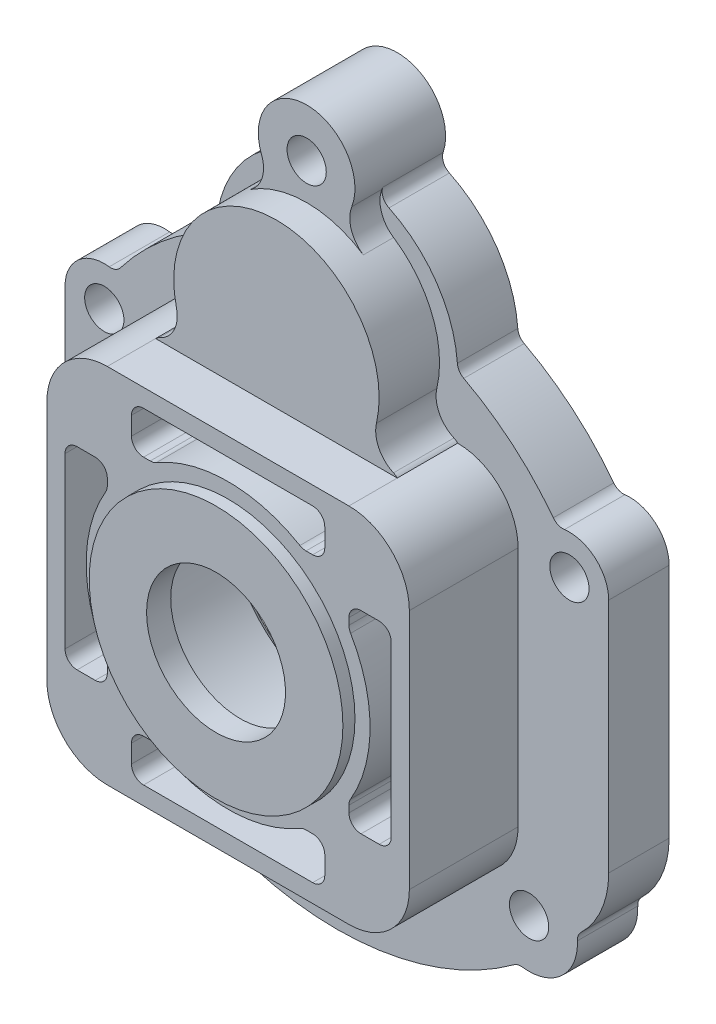
from build123d import *

# Parameters (mm, degrees)
SKETCH_1_R               = 8
EXTRUDE_1_DEPTH          = 10
FILLET_2_R               = 2
EXTRUDE_2_DEPTH          = 18
SKETCH_3_R               = 21
EXTRUDE_3_DEPTH          = 2
EXTRUDE_4_DEPTH          = 10
EXTRUDE_5_DEPTH          = 5
SKETCH_7_R               = 3.25
CUT_EXTRUDE_1_DEPTH      = 86.387352847
SKETCH_8_R               = 3.25
CUT_EXTRUDE_2_DEPTH      = 87.406018443
SKETCH_9_R               = 4
CUT_EXTRUDE_3_DEPTH      = 87.406018443
CUT_EXTRUDE_5_DEPTH      = 6.5
SKETCH_11_R              = 13
CUT_EXTRUDE_6_DEPTH      = 9
SKETCH_12_R              = 11.8
CUT_EXTRUDE_7_DEPTH      = 0.5
CHAMFER_1_SIZE           = 1
FILLET_3_R               = 2
CUT_EXTRUDE_START        = 4
SKETCH_13_R              = 21
CUT_EXTRUDE_8_DEPTH      = 86.25245111
CHAMFER_2_SIZE           = 1
SKETCH_14_R              = 11.5
CUT_EXTRUDE_9_DEPTH      = 88.988635791
CUT_EXTRUDE_10_DEPTH     = 8
PATTERN_CIRCULAR_1_COUNT = 4
CUT_EXTRUDE_START_2      = -8
CUT_EXTRUDE_11_DEPTH     = 8
PATTERN_CIRCULAR_2_COUNT = 4


with BuildPart() as part:
    # 草图1 → 凸台-拉伸1 (new body)
    with BuildSketch(Plane.XY):
        with BuildLine():
            ThreePointArc((-36.579346649, 26.209757701), (-42.357833149, 25.231359612), (-45, 20))
            Line((-45, 20), (-45, -19.12073832))
            ThreePointArc((-45, -19.12073832), (-43.615594549, -25.414829603), (-39.717921989, -30.547110982))
            ThreePointArc((-39.717921989, -30.547110982), (-31.181422307, -23.845316622), (-23.819805153, -31.819805153))
            ThreePointArc((-23.819805153, -31.819805153), (-25.552491485, -36.791804689), (-30, -39.610075316))
            ThreePointArc((-30, -39.610075316), (0, -49.688611034), (30, -39.610075316))
            ThreePointArc((30, -39.610075316), (26.363542801, -25.969232434), (39.717921989, -30.547110982))
            ThreePointArc((39.717921989, -30.547110982), (43.615594549, -25.414829603), (45, -19.12073832))
            Line((45, -19.12073832), (45, 20))
            ThreePointArc((45, 20), (42.357833149, 25.231359612), (36.579346649, 26.209757701))
            ThreePointArc((36.579346649, 26.209757701), (29.154045733, 34.278880049), (19.997558445, 40.3125))
            ThreePointArc((19.997558445, 40.3125), (16.283994711, 51.611697389), (6.811497841, 58.804347826))
            ThreePointArc((6.811497841, 58.804347826), (0, 55), (-6.811497841, 58.804347826))
            ThreePointArc((-6.811497841, 58.804347826), (-16.283994711, 51.611697389), (-19.997558445, 40.3125))
            ThreePointArc((-19.997558445, 40.3125), (-29.154045733, 34.278880049), (-36.579346649, 26.209757701))
        make_face()
        with Locations((0, 63)):
            Circle(SKETCH_1_R)
        with Locations((-31.819805153, -31.819805153)):
            Circle(SKETCH_1_R)
        with Locations((31.819805153, -31.819805153)):
            Circle(SKETCH_1_R)
    extrude(amount=EXTRUDE_1_DEPTH)

    # 圆角2
    fillet_2_edges = [part.edges().sort_by_distance(p)[0] for p in [
        (39.717921989, -30.547110982, 5),
        (30, -39.610075316, 5),
        (-30, -39.610075316, 5),
        (-39.717921989, -30.547110982, 5),
        (-36.579346649, 26.209757701, 5),
        (-19.997558445, 40.3125, 5),
        (-6.811497841, 58.804347826, 5),
        (6.811497841, 58.804347826, 5),
        (19.997558445, 40.3125, 5),
        (36.579346649, 26.209757701, 5),
    ]]
    fillet(fillet_2_edges, radius=FILLET_2_R)

    # 草图2 → 凸台-拉伸2 (add)
    with BuildSketch(Plane.XY.offset(10)):
        with BuildLine():
            Line((-20, -30), (20, -30))
            ThreePointArc((20, -30), (27.071067812, -27.071067812), (30, -20))
            Line((30, -20), (30, 20))
            ThreePointArc((30, 20), (27.071067812, 27.071067812), (20, 30))
            Line((20, 30), (-20, 30))
            ThreePointArc((-20, 30), (-27.071067812, 27.071067812), (-30, 20))
            Line((-30, 20), (-30, -20))
            ThreePointArc((-30, -20), (-27.071067812, -27.071067812), (-20, -30))
        make_face()
    extrude(amount=EXTRUDE_2_DEPTH)

    # 草图3 → 凸台-拉伸3 (add)
    with BuildSketch(Plane.XY.offset(28)):
        Circle(SKETCH_3_R)
    extrude(amount=EXTRUDE_3_DEPTH)

    # 草图4 → 凸台-拉伸4 (add)
    with BuildSketch(Plane.XY.offset(10)):
        with BuildLine():
            ThreePointArc((-16.553884547, 36.131032903), (-17.425164742, 31.989783443), (-21.160112951, 30))
            Line((-21.160112951, 30), (21.310598843, 30))
            ThreePointArc((21.310598843, 30), (17.47215611, 31.9355382), (16.554897625, 36.135370055))
            ThreePointArc((16.554897625, 36.135370055), (-0.002226949, 56.999999854), (-16.553884547, 36.131032903))
        make_face()
    extrude(amount=EXTRUDE_4_DEPTH)

    # 草图6 → 凸台-拉伸5 (add)
    with BuildSketch(Plane.XY.offset(10)):
        with BuildLine():
            ThreePointArc((-7.470203448, 60.137123746), (-7.377663721, 56.821749655), (-9.380198648, 54.177865613))
            ThreePointArc((-9.380198648, 54.177865613), (0, 57), (9.380198648, 54.177865613))
            ThreePointArc((9.380198648, 54.177865613), (7.377663721, 56.821749655), (7.470203448, 60.137123746))
            ThreePointArc((7.470203448, 60.137123746), (7.53311099, 60.307001891), (7.592155936, 60.47826087))
            ThreePointArc((7.592155936, 60.47826087), (0, 71), (-7.592155936, 60.47826087))
            ThreePointArc((-7.592155936, 60.47826087), (-7.53311099, 60.307001891), (-7.470203448, 60.137123746))
        make_face()
    extrude(amount=EXTRUDE_5_DEPTH)

    # 草图7 → 切除-拉伸1 (cut, through all)
    with BuildSketch(Plane.XY.offset(15)):
        with Locations((0, 63)):
            Circle(SKETCH_7_R)
    extrude(amount=-CUT_EXTRUDE_1_DEPTH, mode=Mode.SUBTRACT)

    # 草图8 → 切除-拉伸2 (cut, through all)
    with BuildSketch(Plane.XY.offset(10)):
        with Locations((-38.5, 20)):
            Circle(SKETCH_8_R)
        with Locations((38.5, 20)):
            Circle(SKETCH_8_R)
        with Locations((31.819805153, -31.819805153)):
            Circle(SKETCH_8_R)
    extrude(amount=-CUT_EXTRUDE_2_DEPTH, mode=Mode.SUBTRACT)

    # 草图9 → 切除-拉伸3 (cut, through all)
    with BuildSketch(Plane.XY.offset(10)):
        with Locations((-31.819805153, -31.819805153)):
            Circle(SKETCH_9_R)
    extrude(amount=-CUT_EXTRUDE_3_DEPTH, mode=Mode.SUBTRACT)

    # 草图10 → 切除-拉伸5 (cut)
    with BuildSketch(Plane(origin=(0, 0, 0), x_dir=(-1, 0, 0), z_dir=(0, 0, -1))):
        with BuildLine():
            ThreePointArc((-24.321193093, -38.677238071), (-12.655826566, -43.900788514), (0, -45.688611034))
            Line((0, -45.688611034), (0, 56))
            ThreePointArc((0, 56), (-3.538606948, 55.603789952), (-6.901959942, 54.434782609))
            ThreePointArc((-6.901959942, 54.434782609), (-13.224018384, 49.006960519), (-15.95959516, 41.136363636))
            ThreePointArc((-15.95959516, 41.136363636), (-16.919254436, 38.284165602), (-19.143025046, 36.256648936))
            ThreePointArc((-19.143025046, 36.256648936), (-26.194471911, 31.541237155), (-32.124620679, 25.475650065))
            ThreePointArc((-32.124620679, 25.475650065), (-32.549398196, 24.413502723), (-32.322551342, 23.292283111))
            ThreePointArc((-32.322551342, 23.292283111), (-32.600506447, 16.232245255), (-38.888888889, 13.010810817))
            ThreePointArc((-38.888888889, 13.010810817), (-40.374368542, 12.466865937), (-41, 11.013899622))
            Line((-41, 11.013899622), (-41, -19.12073832))
            ThreePointArc((-41, -19.12073832), (-40.601810391, -22.053589566), (-39.43606974, -24.774107922))
            ThreePointArc((-39.43606974, -24.774107922), (-38.117648217, -25.706378222), (-36.540297588, -25.360939063))
            ThreePointArc((-36.540297588, -25.360939063), (-26.41858125, -25.918383262), (-24.969195392, -35.951287442))
            ThreePointArc((-24.969195392, -35.951287442), (-25.202321489, -37.446700862), (-24.321193093, -38.677238071))
        make_face()
        with BuildLine():
            Line((0, 56), (0, -45.688611034))
            ThreePointArc((0, -45.688611034), (12.655826566, -43.900788514), (24.321193093, -38.677238071))
            ThreePointArc((24.321193093, -38.677238071), (25.202321489, -37.446700862), (24.969195392, -35.951287442))
            ThreePointArc((24.969195392, -35.951287442), (26.41858125, -25.918383262), (36.540297588, -25.360939063))
            ThreePointArc((36.540297588, -25.360939063), (38.117648217, -25.706378222), (39.43606974, -24.774107922))
            ThreePointArc((39.43606974, -24.774107922), (40.601810391, -22.053589566), (41, -19.12073832))
            Line((41, -19.12073832), (41, 11.013899622))
            ThreePointArc((41, 11.013899622), (40.374368542, 12.466865937), (38.888888889, 13.010810817))
            ThreePointArc((38.888888889, 13.010810817), (32.600506447, 16.232245255), (32.322551342, 23.292283111))
            ThreePointArc((32.322551342, 23.292283111), (32.549398196, 24.413502723), (32.124620679, 25.475650065))
            ThreePointArc((32.124620679, 25.475650065), (26.194471911, 31.541237155), (19.143025046, 36.256648936))
            ThreePointArc((19.143025046, 36.256648936), (16.919254436, 38.284165602), (15.95959516, 41.136363636))
            ThreePointArc((15.95959516, 41.136363636), (13.224018384, 49.006960519), (6.901959942, 54.434782609))
            ThreePointArc((6.901959942, 54.434782609), (3.538606948, 55.603789952), (0, 56))
        make_face()
    extrude(amount=-CUT_EXTRUDE_5_DEPTH, mode=Mode.SUBTRACT)

    # 草图11 → 切除-拉伸6 (cut)
    with BuildSketch(Plane(origin=(0, 0, 6.5), x_dir=(-1, 0, 0), z_dir=(0, 0, -1))):
        with Locations((0, 40)):
            Circle(SKETCH_11_R)
    extrude(amount=-CUT_EXTRUDE_6_DEPTH, mode=Mode.SUBTRACT)

    # 草图12 → 切除-拉伸7 (cut)
    with BuildSketch(Plane(origin=(0, 0, 15.5), x_dir=(-1, 0, 0), z_dir=(0, 0, -1))):
        with Locations((0, 40)):
            Circle(SKETCH_12_R)
    extrude(amount=-CUT_EXTRUDE_7_DEPTH, mode=Mode.SUBTRACT)

    # 倒角1
    chamfer_1_edges = [part.edges().sort_by_distance(p)[0] for p in [
        (13, 40, 6.5),
    ]]
    chamfer(chamfer_1_edges, length=CHAMFER_1_SIZE)

    # 圆角3
    # the kernel refuses this fillet: 2 mm, written as the material it takes off along each edge
    with BuildSketch(Plane(origin=(21.310598843, 30, 10), x_dir=(-0.9754566193335542, 0.22019169784157075, 0), z_dir=(0, 0, 1))) as fillet_3_piece_1:
        with BuildLine():
            CenterArc((2.376172628, 1.960398228), FILLET_3_R, 236.710464592, 21.868665736)
            Line((1.278432316, 0.288582984), (0, 0))
            ThreePointArc((0, 0), (0.990071928, 0.09900443), (1.980143856, 0))
        make_face()
    extrude(amount=14.950359641, mode=Mode.SUBTRACT)
    with BuildSketch(Plane(origin=(-21.160112951, 30, 10), x_dir=(0.9722805183017327, 0.23381743675550404, 0), z_dir=(0, 0, 1))) as fillet_3_piece_2:
        with BuildLine():
            CenterArc((2.18925855, -1.96643464), FILLET_3_R, 100.51181111, 21.537684626)
            Line((1.127955221, -0.271254637), (0, 0))
            ThreePointArc((0, 0), (0.912191062, -0.083913399), (1.824382125, 0))
        make_face()
    extrude(amount=14.560955312, mode=Mode.SUBTRACT)

    # 草图13 → 切除-拉伸8 (cut, through all)
    with BuildSketch(Plane(origin=(0, 0, 30), x_dir=(-1, 0, 0), z_dir=(0, 0, -1)).offset(CUT_EXTRUDE_START)):
        with Locations(Location((0, 0, 0), (0, 0, 180))):
            Circle(SKETCH_13_R)
    extrude(amount=CUT_EXTRUDE_8_DEPTH, mode=Mode.SUBTRACT)

    # 倒角2
    chamfer_2_edges = [part.edges().sort_by_distance(p)[0] for p in [
        (-21, 0, 6.5),
    ]]
    chamfer(chamfer_2_edges, length=CHAMFER_2_SIZE)

    # 草图14 → 切除-拉伸9 (cut, through all)
    with BuildSketch(Plane(origin=(0, 0, 26), x_dir=(-1, 0, 0), z_dir=(0, 0, -1))):
        Circle(SKETCH_14_R)
    extrude(amount=-CUT_EXTRUDE_9_DEPTH, mode=Mode.SUBTRACT)

    # 草图15 → 切除-拉伸10 (cut)
    with BuildSketch(Plane(origin=(0, 0, 6.5), x_dir=(-1, 0, 0), z_dir=(0, 0, -1))):
        with BuildLine():
            Line((12.893796958, 20), (14, 20))
            ThreePointArc((14, 20), (15.414213562, 20.585786438), (16, 22))
            Line((16, 22), (16, 25))
            ThreePointArc((16, 25), (15.414213562, 26.414213562), (14, 27))
            Line((14, 27), (6, 27))
            ThreePointArc((6, 27), (4.585786438, 26.414213562), (4, 25))
            Line((4, 25), (4, 24.784067463))
            ThreePointArc((4, 24.784067463), (4.428189504, 23.547373578), (5.529411765, 22.840219034))
            ThreePointArc((5.529411765, 22.840219034), (8.79997427, 21.790145774), (11.882518765, 20.274509804))
            ThreePointArc((11.882518765, 20.274509804), (12.369860126, 20.069847106), (12.893796958, 20))
        make_face()
        with BuildLine():
            Line((-14, 27), (-6, 27))
            ThreePointArc((-6, 27), (-4.585786438, 26.414213562), (-4, 25))
            Line((-4, 25), (-4, 24.784067463))
            ThreePointArc((-4, 24.784067463), (-4.428189504, 23.547373578), (-5.529411765, 22.840219034))
            ThreePointArc((-5.529411765, 22.840219034), (-8.79997427, 21.790145774), (-11.882518765, 20.274509804))
            ThreePointArc((-11.882518765, 20.274509804), (-12.369860126, 20.069847106), (-12.893796958, 20))
            Line((-12.893796958, 20), (-14, 20))
            ThreePointArc((-14, 20), (-15.414213562, 20.585786438), (-16, 22))
            Line((-16, 22), (-16, 25))
            ThreePointArc((-16, 25), (-15.414213562, 26.414213562), (-14, 27))
        make_face()
    cut_extrude_10 = extrude(amount=-CUT_EXTRUDE_10_DEPTH, mode=Mode.SUBTRACT)

    # 阵列(圆周)1: 切除-拉伸10 ×4 about axis
    pattern_circular_1_axis = Axis((0, 0, 0), (0, 0, 1))
    for i in range(1, PATTERN_CIRCULAR_1_COUNT):
        add(cut_extrude_10.rotate(pattern_circular_1_axis, i * 360 / PATTERN_CIRCULAR_1_COUNT), mode=Mode.SUBTRACT)

    # 草图16 → 切除-拉伸11 (cut)
    with BuildSketch(Plane.XY.offset(28).offset(CUT_EXTRUDE_START_2)):
        with BuildLine():
            Line((14, 27), (6, 27))
            Line((6, 27), (-6, 27))
            Line((-6, 27), (-14, 27))
            ThreePointArc((-14, 27), (-15.414213562, 26.414213562), (-16, 25))
            Line((-16, 25), (-16, 22))
            ThreePointArc((-16, 22), (-15.414213562, 20.585786438), (-14, 20))
            Line((-14, 20), (-12.893796958, 20))
            ThreePointArc((-12.893796958, 20), (-12.369860126, 20.069847106), (-11.882518765, 20.274509804))
            ThreePointArc((-11.882518765, 20.274509804), (-8.79997427, 21.790145774), (-5.529411765, 22.840219034))
            ThreePointArc((-5.529411765, 22.840219034), (0, 23.5), (5.529411765, 22.840219034))
            ThreePointArc((5.529411765, 22.840219034), (8.79997427, 21.790145774), (11.882518765, 20.274509804))
            ThreePointArc((11.882518765, 20.274509804), (12.369860126, 20.069847106), (12.893796958, 20))
            Line((12.893796958, 20), (14, 20))
            ThreePointArc((14, 20), (15.414213562, 20.585786438), (16, 22))
            Line((16, 22), (16, 25))
            ThreePointArc((16, 25), (15.414213562, 26.414213562), (14, 27))
        make_face()
    cut_extrude_11 = extrude(amount=CUT_EXTRUDE_11_DEPTH, mode=Mode.SUBTRACT)

    # 阵列(圆周)2: 切除-拉伸11 ×4 about axis
    pattern_circular_2_axis = Axis((0, 0, 0), (0, 0, 1))
    for i in range(1, PATTERN_CIRCULAR_2_COUNT):
        add(cut_extrude_11.rotate(pattern_circular_2_axis, i * 360 / PATTERN_CIRCULAR_2_COUNT), mode=Mode.SUBTRACT)


solid = part.part
